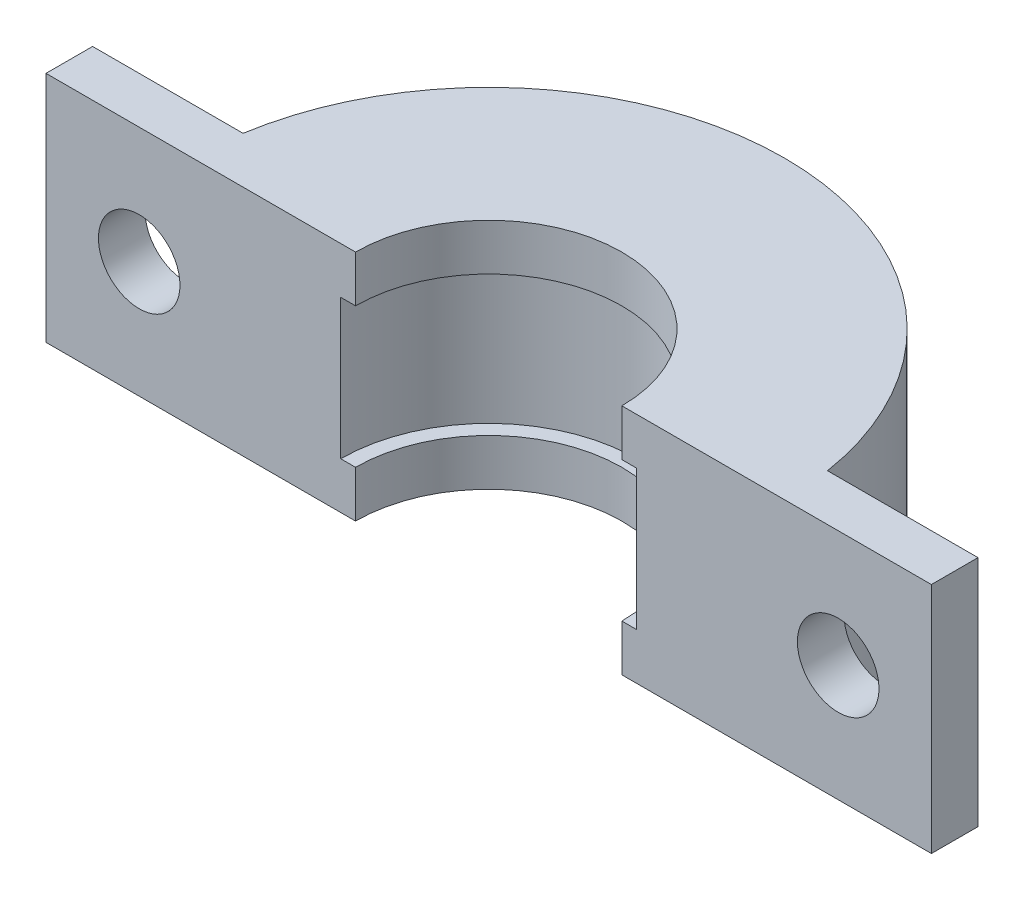
from build123d import *

# Parameters (mm, degrees)
BOSS_EXTRUDE1_DEPTH = 5
CUT_EXTRUDE1_DEPTH  = 3
SKETCH3_W           = 8
SKETCH3_H           = 10
SKETCH3_R           = 1.75
BOSS_EXTRUDE2_DEPTH = 2


with BuildPart() as part:
    # Sketch1 → Boss-Extrude1 (new, symmetric)
    with BuildSketch(Plane(origin=(0, 0, 0), x_dir=(1, 0, 0), z_dir=(0, 1, 0))):
        with BuildLine():
            Line((5.715, 0), (12.7, 0))
            ThreePointArc((12.7, 0), (0, 12.7), (-12.7, 0))
            Line((-12.7, 0), (-5.715, 0))
            ThreePointArc((-5.715, 0), (0, 5.715), (5.715, 0))
        make_face()
    extrude(amount=BOSS_EXTRUDE1_DEPTH, both=True)

    # Sketch2 → Cut-Extrude1 (cut, symmetric)
    with BuildSketch(Plane(origin=(0, 0, 0), x_dir=(1, 0, 0), z_dir=(0, 1, 0))):
        with BuildLine():
            ThreePointArc((6.35, 0), (0, 6.35), (-6.35, 0))
            Line((-6.35, 0), (6.35, 0))
        make_face()
    extrude(amount=CUT_EXTRUDE1_DEPTH, both=True, mode=Mode.SUBTRACT)

    # Sketch3 → Boss-Extrude2 (add)
    # profile 1 of 2: a face of its own
    with BuildSketch(Plane.XY):
        with Locations((-15, 0)):
            Rectangle(SKETCH3_W, SKETCH3_H)
        with Locations((-15, 0)):
            Circle(SKETCH3_R, mode=Mode.SUBTRACT)
    # profile 2 of 2: a face of its own
    with BuildSketch(Plane.XY):
        with Locations((15, 0)):
            Rectangle(SKETCH3_W, SKETCH3_H)
        with Locations((15, 0)):
            Circle(SKETCH3_R, mode=Mode.SUBTRACT)
    extrude(amount=-BOSS_EXTRUDE2_DEPTH)


solid = part.part
